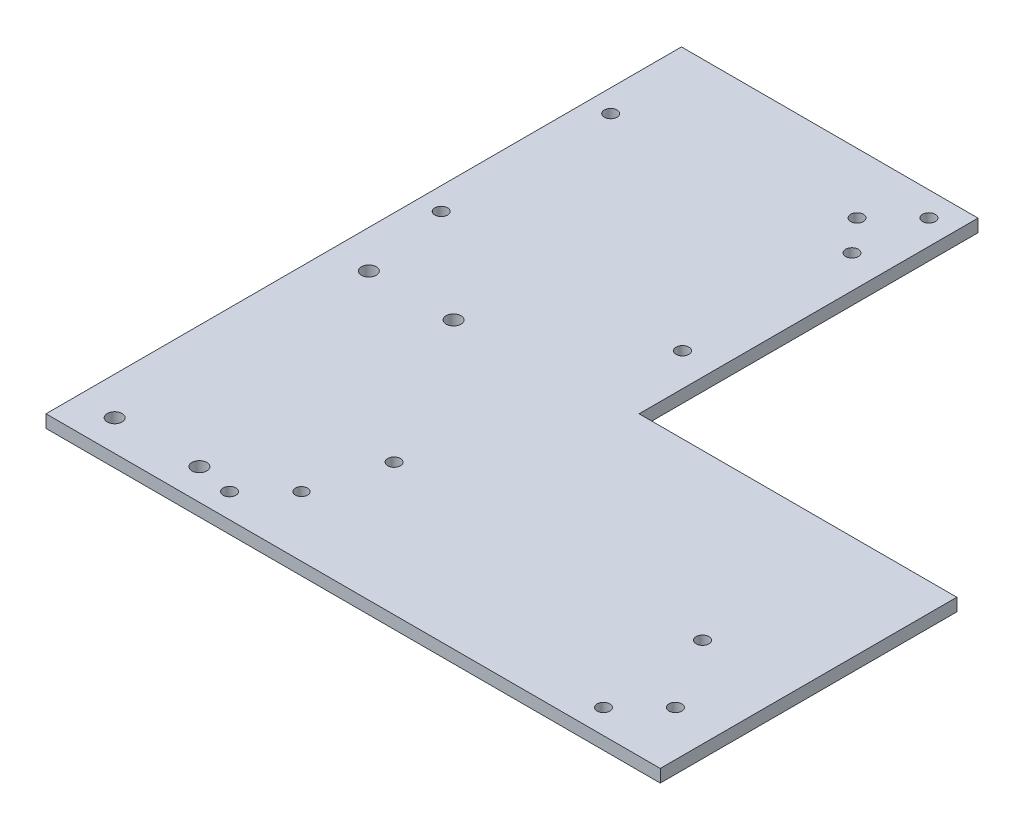
from build123d import *

# Parameters (mm, degrees)
SKETCH1_R           = 1.5
SKETCH1_R_2         = 1.44463942
SKETCH1_R_3         = 1.75
BOSS_EXTRUDE1_DEPTH = 3


with BuildPart() as part:
    # Sketch1 → Boss-Extrude1 (new body)
    with BuildSketch(Plane(origin=(0, 0, 0), x_dir=(1, 0, 0), z_dir=(0, 1, 0))):
        Polygon((-72.5, -35), (72.5, -35), (72.5, 35), (-2.5, 35), (-2.5, 115), (-72.5, 115), (-72.5, 35), align=None)
        with Locations((-34.926368805, -29.242640687)):
            Circle(SKETCH1_R, mode=Mode.SUBTRACT)
        with Locations((-26.441087431, -20.757359313)):
            Circle(SKETCH1_R_2, mode=Mode.SUBTRACT)
        with Locations((53.338095075, -29.242640687)):
            Circle(SKETCH1_R, mode=Mode.SUBTRACT)
        with Locations((61.823376449, -20.757359313)):
            Circle(SKETCH1_R, mode=Mode.SUBTRACT)
        with Locations((-16.814355015, 100.757359313)):
            Circle(SKETCH1_R, mode=Mode.SUBTRACT)
        with Locations((-8.329073641, 109.242640687)):
            Circle(SKETCH1_R, mode=Mode.SUBTRACT)
        with Locations((-21.53520264, -3.802185791)):
            Circle(SKETCH1_R, mode=Mode.SUBTRACT)
        with Locations((51.273857311, -3.802185791)):
            Circle(SKETCH1_R, mode=Mode.SUBTRACT)
        with Locations((-63.584566194, -27.710636817)):
            Circle(SKETCH1_R_3, mode=Mode.SUBTRACT)
        with Locations((-43.584566194, -27.710636817)):
            Circle(SKETCH1_R_3, mode=Mode.SUBTRACT)
        with Locations((-43.584566194, 32.289363183)):
            Circle(SKETCH1_R_3, mode=Mode.SUBTRACT)
        with Locations((-63.584566194, 32.289363183)):
            Circle(SKETCH1_R_3, mode=Mode.SUBTRACT)
        with Locations((-67.219523752, 53.009730632)):
            Circle(SKETCH1_R, mode=Mode.SUBTRACT)
        with Locations((-67.219523752, 93.009730632)):
            Circle(SKETCH1_R, mode=Mode.SUBTRACT)
        with Locations((-10.261266871, 93.009730632)):
            Circle(SKETCH1_R, mode=Mode.SUBTRACT)
        with Locations((-10.261266871, 53.009730632)):
            Circle(SKETCH1_R, mode=Mode.SUBTRACT)
    extrude(amount=BOSS_EXTRUDE1_DEPTH)


solid = part.part
